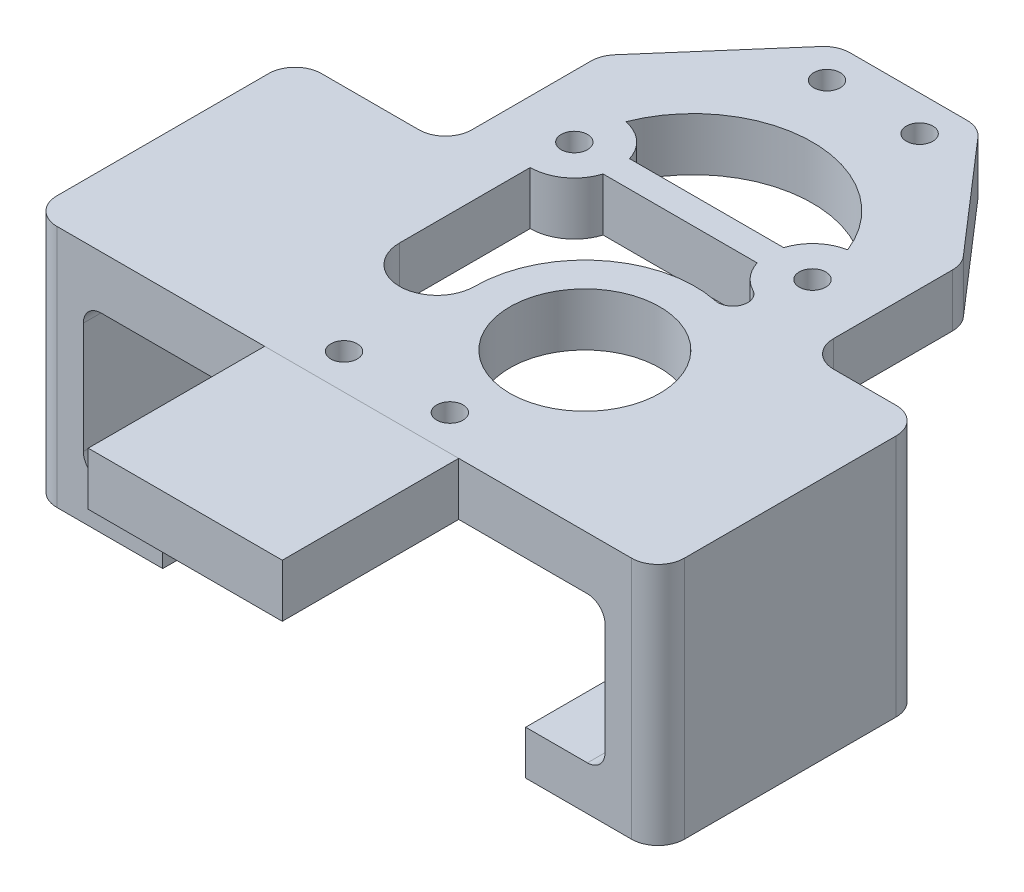
from build123d import *

# Parameters (mm, degrees)
SKETCH1_R                = 1.5
SKETCH1_R_2              = 8.5
SKETCH1_W                = 6
SKETCH1_H                = 30
SKETCH1_W_2              = 22
SKETCH1_H_2              = 20
BOSS_EXTRUDE1_DEPTH      = 6
SKETCH1_5_W              = 6
SKETCH1_5_H              = 30
RESSALTO_EXTRUS_O1_DEPTH = 21.6
ESBO_O1_W                = 30
ESBO_O1_H                = 5
RESSALTO_EXTRUS_O2_DEPTH = 9
CORTE_EXTRUS_O1_REACH    = 79.561
ESBO_O2_W                = 5
ESBO_O2_H                = 15
FILETE2_R                = 2
FILETE2_OF_ESPELHAR1_R   = 2
FILLET1_R                = 3
FILETE1_R                = 2
ESBO_O4_W                = 2
ESBO_O4_H                = 4
ESBO_O4_W_2              = 45.13986754
CORTE_EXTRUS_O3_DEPTH    = 1.5
FILETE3_R                = 0.3


with BuildPart() as part:
    # Sketch1 → Boss-Extrude1 (new body)
    # profile 1 of 6: a face of its own
    with BuildSketch(Plane(origin=(0, 0, 0), x_dir=(1, 0, 0), z_dir=(0, 1, 0))):
        Polygon((-20.510374251, 47.623346162), (-8, 62), (8, 62), (20.489621783, 47.605313925), (20.489621783, 17.605313925), (11, 0), (-11, 0), (-20.510374251, 17.623346162), align=None)
        with Locations(Location((13.5, 37.605313925, 0), (0, 0, 270))):
            Circle(SKETCH1_R, mode=Mode.SUBTRACT)
        with Locations(Location((-13.5, 37.605313925, 0), (0, 0, 270))):
            Circle(SKETCH1_R, mode=Mode.SUBTRACT)
        with Locations(Location((5.25, 57.999859765, 0), (0, 0, 270))):
            Circle(SKETCH1_R, mode=Mode.SUBTRACT)
        with Locations(Location((-5.25, 57.999859765, 0), (0, 0, 270))):
            Circle(SKETCH1_R, mode=Mode.SUBTRACT)
        with Locations(Location((7.519679741, 17.780252273, 0), (0, 0, 270))):
            Circle(SKETCH1_R_2, mode=Mode.SUBTRACT)
        with Locations(Location((6, 4, 0), (0, 0, 270))):
            Circle(SKETCH1_R, mode=Mode.SUBTRACT)
        with Locations(Location((-6, 4, 0), (0, 0, 270))):
            Circle(SKETCH1_R, mode=Mode.SUBTRACT)
        with BuildLine():
            ThreePointArc((10.062695821, 30.018841621), (11.998189223, 31.105465162), (11.187975781, 33.171969363))
            ThreePointArc((11.187975781, 33.171969363), (9.667400631, 34.394210987), (8.730303993, 36.105313925))
            Line((8.730303993, 36.105313925), (-8.730303993, 36.105313925))
            ThreePointArc((-8.730303993, 36.105313925), (-10.541960108, 33.574185051), (-13.5, 32.605313925))
            Line((-13.5, 32.605313925), (-13.5, 17.787899155))
            ThreePointArc((-13.5, 17.787899155), (-9.241131059, 13.528058523), (-4.980318958, 17.785955551))
            ThreePointArc((-4.980318958, 17.785955551), (-0.366780245, 27.478383479), (10.062695821, 30.018841621))
        make_face(mode=Mode.SUBTRACT)
        with BuildLine():
            ThreePointArc((12.574074074, 42.518832133), (0, 51.105313925), (-12.574074074, 42.518832133))
            ThreePointArc((-12.574074074, 42.518832133), (-10.179901517, 41.34388933), (-8.730303993, 39.105313925))
            Line((-8.730303993, 39.105313925), (8.730303993, 39.105313925))
            ThreePointArc((8.730303993, 39.105313925), (10.179901517, 41.34388933), (12.574074074, 42.518832133))
        make_face(mode=Mode.SUBTRACT)
    # profile 2 of 6: a face of its own
    with BuildSketch(Plane(origin=(0, 0, 0), x_dir=(1, 0, 0), z_dir=(0, 1, 0))):
        Polygon((20.489621783, 17.605313925), (11, 0), (27.589621783, 0), (27.589621783, 30), (20.489621783, 30), align=None)
    # profile 3 of 6: a face of its own
    with BuildSketch(Plane(origin=(0, 0, 0), x_dir=(1, 0, 0), z_dir=(0, 1, 0))):
        with Locations((30.589621783, 15)):
            Rectangle(SKETCH1_W, SKETCH1_H)
    # profile 4 of 6: a face of its own
    with BuildSketch(Plane(origin=(0, 0, 0), x_dir=(1, 0, 0), z_dir=(0, 1, 0))):
        with Locations((0, -10)):
            Rectangle(SKETCH1_W_2, SKETCH1_H_2)
    # profile 5 of 6: a face of its own
    with BuildSketch(Plane(origin=(0, 0, 0), x_dir=(1, 0, 0), z_dir=(0, 1, 0))):
        Polygon((-31.550245757, 0), (-11, 0), (-20.510374251, 17.623346162), (-20.510374251, 30), (-31.550245757, 30), align=None)
    # profile 6 of 6: a face of its own
    with BuildSketch(Plane(origin=(0, 0, 0), x_dir=(1, 0, 0), z_dir=(0, 1, 0))):
        with Locations((-34.550245757, 15)):
            Rectangle(SKETCH1_W, SKETCH1_H)
    extrude(amount=BOSS_EXTRUDE1_DEPTH)

    # Sketch1<5> → Ressalto-extrusão1 (add)
    with BuildSketch(Plane(origin=(0, 0, 0), x_dir=(1, 0, 0), z_dir=(0, 1, 0))):
        with Locations((30.589621783, 15)):
            Rectangle(SKETCH1_5_W, SKETCH1_5_H)
    ressalto_extrus_o1 = extrude(amount=-RESSALTO_EXTRUS_O1_DEPTH)

    # Esboço1 → Ressalto-extrusão2 (add)
    with BuildSketch(Plane.ZY.offset(-27.589621783)):
        with Locations((-15, -19.1)):
            Rectangle(ESBO_O1_W, ESBO_O1_H)
    ressalto_extrus_o2 = extrude(amount=RESSALTO_EXTRUS_O2_DEPTH)

    # Esboço2 → Corte-extrusão1 (cut, up to next)
    with BuildSketch(Plane.XZ.offset(21.6), mode=Mode.PRIVATE) as corte_extrus_o1_sk1:
        with Locations((23.089621783, -17.9)):
            Rectangle(ESBO_O2_W, ESBO_O2_H)
    corte_extrus_o1_tool1 = extrude(corte_extrus_o1_sk1.sketch, amount=-CORTE_EXTRUS_O1_REACH, mode=Mode.PRIVATE) & part.part
    corte_extrus_o1 = corte_extrus_o1_tool1.solids().sort_by_distance((23.089622, -21.6, -17.9))[0]
    add(corte_extrus_o1, mode=Mode.SUBTRACT)

    # Filete2
    filete2_edges = [part.edges().sort_by_distance(p)[0] for p in [
        (25.589621783, -19.1, -25.4),
        (25.589621783, -19.1, -10.4),
        (20.589621783, -19.1, -10.4),
        (20.589621783, -19.1, -25.4),
    ]]
    fillet(filete2_edges, radius=FILETE2_R)

    # Espelhar1: Ressalto-extrusão1, Ressalto-extrusão2, Corte-extrusão1 across plane
    add(ressalto_extrus_o1.mirror(Plane.ZY.offset(1.980311987)))
    add(ressalto_extrus_o2.mirror(Plane.ZY.offset(1.980311987)))
    add(corte_extrus_o1.mirror(Plane.ZY.offset(1.980311987)), mode=Mode.SUBTRACT)

    # Filete2 of Espelhar1
    filete2_of_espelhar1_edges = [part.edges().sort_by_distance(p)[0] for p in [
        (-29.550245757, -19.1, -25.4),
        (-29.550245757, -19.1, -10.4),
        (-24.550245757, -19.1, -10.4),
        (-24.550245757, -19.1, -25.4),
    ]]
    fillet(filete2_of_espelhar1_edges, radius=FILETE2_OF_ESPELHAR1_R)

    # Fillet1
    fillet1_edges = [part.edges().sort_by_distance(p)[0] for p in [
        (-20.510374251, 3, -47.623346162),
        (-8, 3, -62),
        (8, 3, -62),
        (20.489621783, 3, -47.605313925),
        (20.489621783, 3, -30),
        (33.589621783, -7.8, -30),
        (33.589621783, -7.8, 0),
        (-37.550245757, -7.8, 0),
        (-37.550245757, -7.8, -30),
        (-20.510374251, 3, -30),
    ]]
    fillet(fillet1_edges, radius=FILLET1_R)

    # Filete1
    filete1_edges = [part.edges().sort_by_distance(p)[0] for p in [
        (27.589621783, 0, -15),
        (27.589621783, -16.6, -15),
        (-31.550245757, 0, -15),
        (-31.550245757, -16.6, -15),
    ]]
    fillet(filete1_edges, radius=FILETE1_R - 0.0001)  # a hair under: the kernel refuses the full size

    # Esboço4 → Corte-extrusão3 (cut)
    with BuildSketch(Plane.XZ.offset(21.6)):
        with Locations((-23.550245757, -17.9)):
            Rectangle(ESBO_O4_W, ESBO_O4_H)
        with Locations((0.019688013, -17.9)):
            Rectangle(ESBO_O4_W_2, ESBO_O4_H)
    extrude(amount=-CORTE_EXTRUS_O3_DEPTH, mode=Mode.SUBTRACT)

    # Filete3
    filete3_edges = [part.edges().sort_by_distance(p)[0] for p in [
        (19.589621783, -20.1, -19.9),
        (-23.550245757, -20.1, -19.9),
        (19.589621783, -20.1, -15.9),
        (-23.550245757, -20.1, -15.9),
    ]]
    fillet(filete3_edges, radius=FILETE3_R)


solid = part.part
